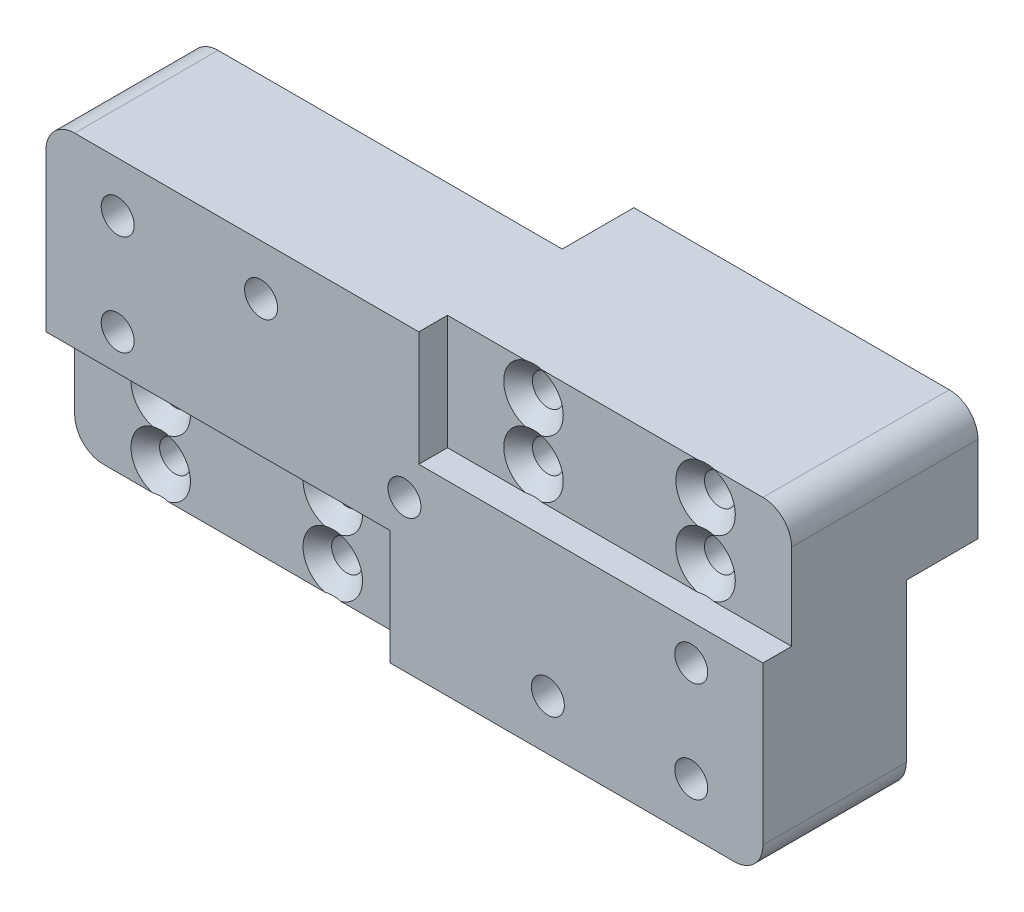
from build123d import *

# Parameters (mm, degrees)
SKETCH1_W             = 24
SKETCH1_H             = 8
SKETCH1_R             = 1.075
BOSS_EXTRUDE1_DEPTH   = 5
BOSS_EXTRUDE1_2_DEPTH = 5
SKETCH2_W             = 50
SKETCH2_H             = 21
SKETCH2_R             = 1.075
BOSS_EXTRUDE2_DEPTH   = 8
BOSS_EXTRUDE3_DEPTH   = 10
CHAMFER1_SIZE         = 1
FILLET1_R             = 2
SKETCH3_R             = 1.15
CUT_EXTRUDE1_DEPTH    = 7


with BuildPart() as part:
    # Sketch1 → Boss-Extrude1 (new body)
    with BuildSketch(Plane.XY):
        with Locations((-8.500045519, -6.479626746)):
            Rectangle(SKETCH1_W, SKETCH1_H)
        with Locations((-14.500045519, -4.479626746)):
            Circle(SKETCH1_R, mode=Mode.SUBTRACT)
        with Locations((-2.500045519, -8.479626746)):
            Circle(SKETCH1_R, mode=Mode.SUBTRACT)
        with Locations(Location((-14.500045519, -8.479626746, 0), (0, 0, 180))):
            Circle(SKETCH1_R, mode=Mode.SUBTRACT)
        with Locations(Location((-2.500045519, -4.479626746, 0), (0, 0, 180))):
            Circle(SKETCH1_R, mode=Mode.SUBTRACT)
    extrude(amount=BOSS_EXTRUDE1_DEPTH)



with BuildPart() as body_2:
    # Sketch1 → Boss-Extrude1 2 (new body)
    with BuildSketch(Plane.XY):
        with Locations((17.499954481, 6.520373254)):
            Rectangle(SKETCH1_W, SKETCH1_H)
        with Locations((11.499954481, 8.520373254)):
            Circle(SKETCH1_R, mode=Mode.SUBTRACT)
        with Locations(Location((11.499954481, 4.520373254, 0), (0, 0, 180))):
            Circle(SKETCH1_R, mode=Mode.SUBTRACT)
        with Locations((23.499954481, 4.520373254)):
            Circle(SKETCH1_R, mode=Mode.SUBTRACT)
        with Locations(Location((23.499954481, 8.520373254, 0), (0, 0, 180))):
            Circle(SKETCH1_R, mode=Mode.SUBTRACT)
    extrude(amount=BOSS_EXTRUDE1_2_DEPTH)


with BuildPart() as part_1:
    add(part.part)

    add(body_2.part)  # Boss-Extrude2 merges body 2
    # Sketch2 → Boss-Extrude2 (add)
    with BuildSketch(Plane.XY.offset(5)):
        with Locations((4.499954481, 0.020373254)):
            Rectangle(SKETCH2_W, SKETCH2_H)
        with Locations((-14.500045519, -8.479626746)):
            Circle(SKETCH2_R, mode=Mode.SUBTRACT)
        with Locations((-2.500045519, -8.479626746)):
            Circle(SKETCH2_R, mode=Mode.SUBTRACT)
        with Locations((-14.500045519, -4.479626746)):
            Circle(SKETCH2_R, mode=Mode.SUBTRACT)
        with Locations((-2.500045519, -4.479626746)):
            Circle(SKETCH2_R, mode=Mode.SUBTRACT)
        with Locations((23.499954481, 8.520373254)):
            Circle(SKETCH2_R, mode=Mode.SUBTRACT)
        with Locations((11.499954481, 8.520373254)):
            Circle(SKETCH2_R, mode=Mode.SUBTRACT)
        with Locations((11.499954481, 4.520373254)):
            Circle(SKETCH2_R, mode=Mode.SUBTRACT)
        with Locations((23.499954481, 4.520373254)):
            Circle(SKETCH2_R, mode=Mode.SUBTRACT)
    extrude(amount=BOSS_EXTRUDE2_DEPTH)

    # Sketch2<6> → Boss-Extrude3 (add)
    with BuildSketch(Plane.XY.offset(5)):
        Polygon((3.499954481, -2.479626746), (3.499954481, -10.479626746), (29.499954481, -10.479626746), (29.499954481, 2.520373254), (5.499954481, 2.520373254), (5.499954481, 10.520373254), (-20.500045519, 10.520373254), (-20.500045519, -2.479626746), align=None)
    extrude(amount=BOSS_EXTRUDE3_DEPTH)

    # Chamfer1
    # the kernel refuses this chamfer: 1 mm, written as the material it takes off along each edge
    with BuildSketch(Plane(origin=(23.499954481, 8.520373254, 13), x_dir=(1, 0, 0), z_dir=(0, -1, 0))) as chamfer1_piece_1:
        Polygon((1.075 + CHAMFER1_SIZE, 0), (1.075, -CHAMFER1_SIZE), (1.075, 0), align=None)
    revolve(axis=Axis((23.499954481, 8.520373254, 13), (0, 0, 1)), mode=Mode.SUBTRACT)
    with BuildSketch(Plane(origin=(11.499954481, 4.520373254, 13), x_dir=(1, 0, 0), z_dir=(0, -1, 0))) as chamfer1_piece_2_section:
        Polygon((1.075 + CHAMFER1_SIZE, 0), (1.075, -CHAMFER1_SIZE), (1.075, 0), align=None)
    chamfer1_piece_2 = revolve(axis=Axis((11.499954481, 4.520373254, 13), (0, 0, 1)), mode=Mode.PRIVATE)
    chamfer1_piece_2 = split(chamfer1_piece_2, bisect_by=Plane(origin=(9.93692483, 2.520373254, 12.511970349), z_dir=(0, 1, 0)), keep=Keep.TOP, mode=Mode.PRIVATE)
    add(chamfer1_piece_2, mode=Mode.SUBTRACT)
    with BuildSketch(Plane(origin=(11.499954481, 8.520373254, 13), x_dir=(1, 0, 0), z_dir=(0, -1, 0))) as chamfer1_piece_3:
        Polygon((1.075 + CHAMFER1_SIZE, 0), (1.075, -CHAMFER1_SIZE), (1.075, 0), align=None)
    revolve(axis=Axis((11.499954481, 8.520373254, 13), (0, 0, 1)), mode=Mode.SUBTRACT)
    with BuildSketch(Plane(origin=(23.499954481, 4.520373254, 13), x_dir=(1, 0, 0), z_dir=(0, -1, 0))) as chamfer1_piece_4_section:
        Polygon((1.075 + CHAMFER1_SIZE, 0), (1.075, -CHAMFER1_SIZE), (1.075, 0), align=None)
    chamfer1_piece_4 = revolve(axis=Axis((23.499954481, 4.520373254, 13), (0, 0, 1)), mode=Mode.PRIVATE)
    chamfer1_piece_4 = split(chamfer1_piece_4, bisect_by=Plane(origin=(21.93692483, 2.520373254, 12.511970349), z_dir=(0, 1, 0)), keep=Keep.TOP, mode=Mode.PRIVATE)
    add(chamfer1_piece_4, mode=Mode.SUBTRACT)
    with BuildSketch(Plane(origin=(-14.500045519, -4.479626746, 13), x_dir=(1, 0, 0), z_dir=(0, -1, 0))) as chamfer1_piece_5_section:
        Polygon((1.075 + CHAMFER1_SIZE, 0), (1.075, -CHAMFER1_SIZE), (1.075, 0), align=None)
    chamfer1_piece_5 = revolve(axis=Axis((-14.500045519, -4.479626746, 13), (0, 0, 1)), mode=Mode.PRIVATE)
    chamfer1_piece_5 = split(chamfer1_piece_5, bisect_by=Plane(origin=(-16.063075173, -2.479626746, 12.511970346), z_dir=(0, -1, 0)), keep=Keep.TOP, mode=Mode.PRIVATE)
    add(chamfer1_piece_5, mode=Mode.SUBTRACT)
    with BuildSketch(Plane(origin=(-14.500045519, -8.479626746, 13), x_dir=(1, 0, 0), z_dir=(0, -1, 0))) as chamfer1_piece_6:
        Polygon((1.075 + CHAMFER1_SIZE, 0), (1.075, -CHAMFER1_SIZE), (1.075, 0), align=None)
    revolve(axis=Axis((-14.500045519, -8.479626746, 13), (0, 0, 1)), mode=Mode.SUBTRACT)
    with BuildSketch(Plane(origin=(-2.500045519, -4.479626746, 13), x_dir=(1, 0, 0), z_dir=(0, -1, 0))) as chamfer1_piece_7_section:
        Polygon((1.075 + CHAMFER1_SIZE, 0), (1.075, -CHAMFER1_SIZE), (1.075, 0), align=None)
    chamfer1_piece_7 = revolve(axis=Axis((-2.500045519, -4.479626746, 13), (0, 0, 1)), mode=Mode.PRIVATE)
    chamfer1_piece_7 = split(chamfer1_piece_7, bisect_by=Plane(origin=(-4.063075173, -2.479626746, 12.511970346), z_dir=(0, -1, 0)), keep=Keep.TOP, mode=Mode.PRIVATE)
    add(chamfer1_piece_7, mode=Mode.SUBTRACT)
    with BuildSketch(Plane(origin=(-2.500045519, -8.479626746, 13), x_dir=(1, 0, 0), z_dir=(0, -1, 0))) as chamfer1_piece_8:
        Polygon((1.075 + CHAMFER1_SIZE, 0), (1.075, -CHAMFER1_SIZE), (1.075, 0), align=None)
    revolve(axis=Axis((-2.500045519, -8.479626746, 13), (0, 0, 1)), mode=Mode.SUBTRACT)

    # Fillet1
    fillet1_edges = [part_1.edges().sort_by_distance(p)[0] for p in [
        (29.499954481, -10.479626746, 9),
        (29.499954481, 10.520373254, 9),
        (-20.500045519, 10.520373254, 10),
        (-20.500045519, -10.479626746, 6.5),
    ]]
    fillet(fillet1_edges, radius=FILLET1_R)

    # Sketch3 → Cut-Extrude1 (cut)
    with BuildSketch(Plane.XY.offset(15)):
        with Locations((4.499954481, 0.020373254)):
            Circle(SKETCH3_R)
        with Locations((24.499954481, 0.020373254)):
            Circle(SKETCH3_R)
        with Locations((-15.500045519, 0.020373254)):
            Circle(SKETCH3_R)
        with Locations((-15.500045519, 7.020373254)):
            Circle(SKETCH3_R)
        with Locations((-5.500045519, 7.020373254)):
            Circle(SKETCH3_R)
        with Locations((14.499954481, -6.979626746)):
            Circle(SKETCH3_R)
        with Locations((24.499954481, -6.979626746)):
            Circle(SKETCH3_R)
    extrude(amount=-CUT_EXTRUDE1_DEPTH, mode=Mode.SUBTRACT)


solid = part_1.part
